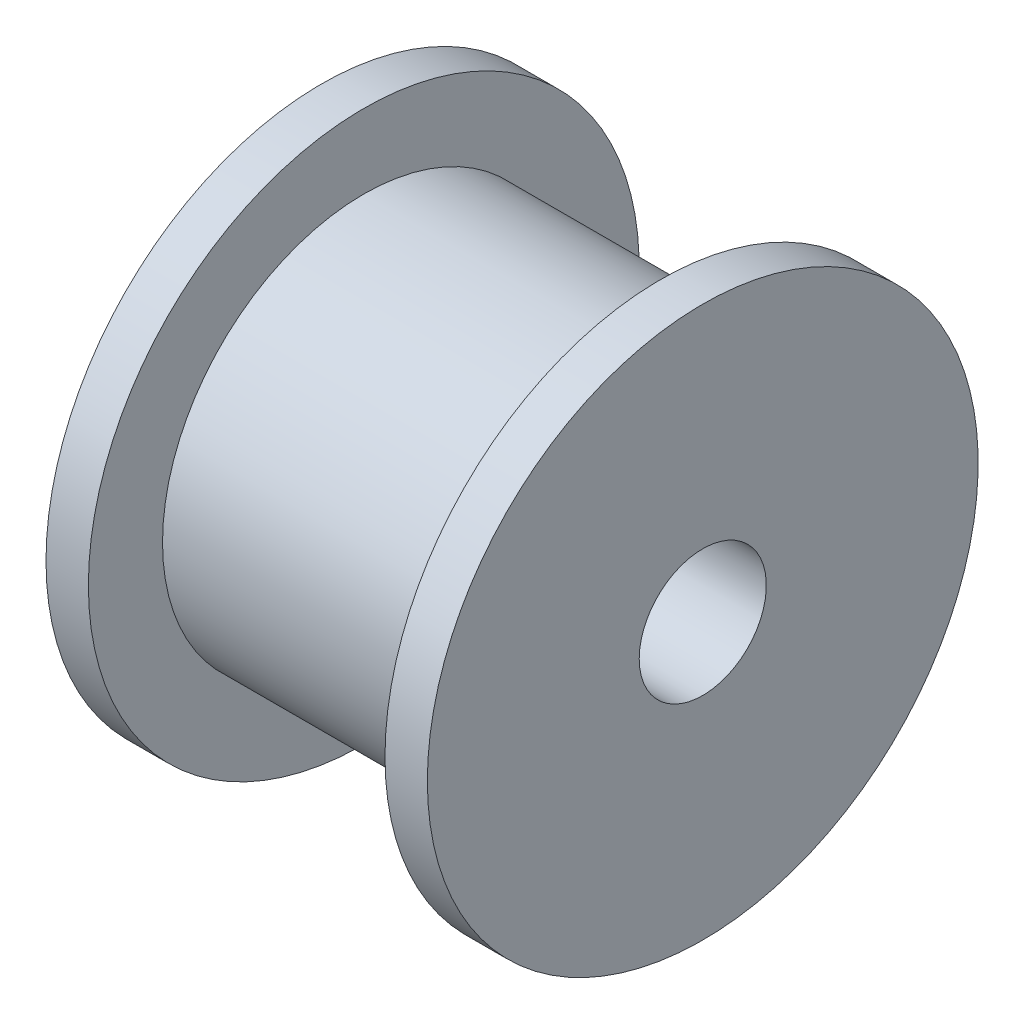
from build123d import *


with BuildPart() as part:
    # Эскиз1 → Повернуть1 (revolve)
    with BuildSketch(Plane.XY):
        Polygon((0, 4.75), (3.5, 4.75), (3.5, 6.5), (4.5, 6.5), (4.5, 1.5), (0, 1.5), (-4.5, 1.5), (-4.5, 6.5), (-3.5, 6.5), (-3.5, 4.75), align=None)
    revolve(axis=Axis((-12.283018868, 0, 0), (1, 0, 0)))


solid = part.part
